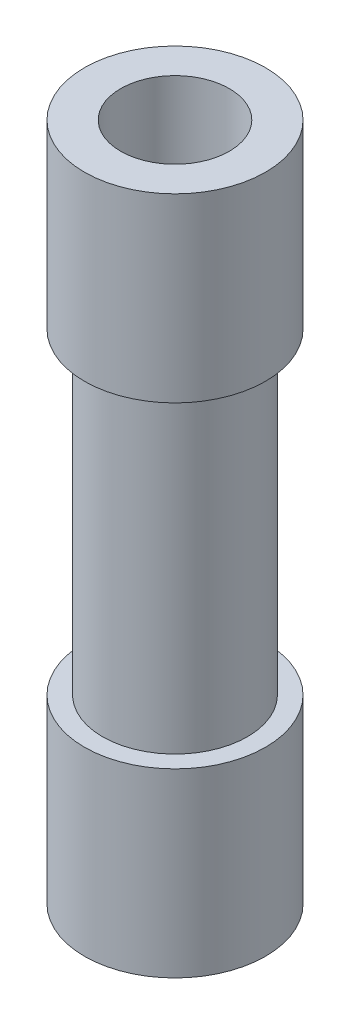
from build123d import *

# Parameters (mm, degrees)
SKETCH2_R               = 1
BOSS_EXTRUDE1_DEPTH     = 7.5
CUT_EXTRUDE1_DEPTH      = 1.75
CUT_EXTRUDE1_DEPTH_BACK = 1.75
SKETCH4_OUTSIDE_W       = 5.604
SKETCH4_OUTSIDE_H       = 5.604
SKETCH4_OUTSIDE_R       = 0.8
SKETCH5_R               = 0.6
CUT_EXTRUDE2_DEPTH      = 7.5


with BuildPart() as part:
    # Sketch2 → Boss-Extrude1 (new body)
    with BuildSketch(Plane(origin=(0, 0, 0), x_dir=(1, 0, 0), z_dir=(0, 1, 0))):
        Circle(SKETCH2_R)
    extrude(amount=BOSS_EXTRUDE1_DEPTH)

    # Sketch4 outside → Cut-Extrude1 (cut, two sides: drawn at the far end of the back side and taken through both)
    with BuildSketch(Plane(origin=(0, 3.75, 0), x_dir=(1, 0, 0), z_dir=(0, 1, 0)).offset(-CUT_EXTRUDE1_DEPTH_BACK)):
        Rectangle(SKETCH4_OUTSIDE_W, SKETCH4_OUTSIDE_H)
        Circle(SKETCH4_OUTSIDE_R, mode=Mode.SUBTRACT)
    extrude(amount=CUT_EXTRUDE1_DEPTH + CUT_EXTRUDE1_DEPTH_BACK, mode=Mode.SUBTRACT)

    # Sketch5 → Cut-Extrude2 (cut)
    with BuildSketch(Plane(origin=(0, 7.5, 0), x_dir=(1, 0, 0), z_dir=(0, 1, 0))):
        Circle(SKETCH5_R)
    extrude(amount=-CUT_EXTRUDE2_DEPTH, mode=Mode.SUBTRACT)


solid = part.part
